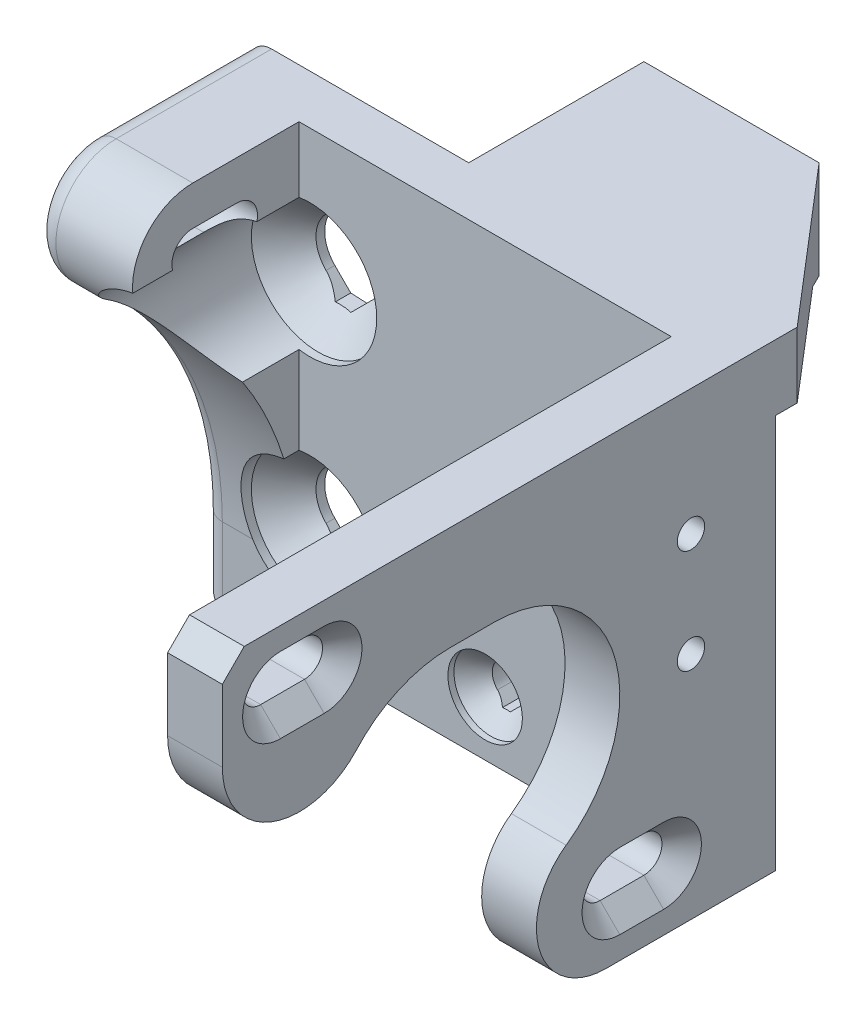
from build123d import *

# Parameters (mm, degrees)
SKETCH1_R                = 3.15
BOSS_EXTRUDE1_DEPTH      = 4.5
SKETCH4_W                = 28
SKETCH4_H                = 6
BOSS_EXTRUDE2_DEPTH      = 16
BOSS_EXTRUDE4_DEPTH      = 6
CHAMFER8_START           = 16
CHAMFER8_DEPTH           = 0.271535122
CHAMFER8_START_2         = -16
CHAMFER8_2_DEPTH         = 10.9
CHAMFER8_START_3         = 16.271535122
CHAMFER8_3_DEPTH         = 5.958767963
CUT_EXTRUDE6_REACH       = 41.038
SKETCH10_R               = 2.15
CUT_EXTRUDE7_REACH       = 48.538
CUT_EXTRUDE7_START       = -7.5
SKETCH11_R               = 4.1
CHAMFER9_SIZE            = 2
SKETCH12_W               = 5
SKETCH12_H               = 42
SKETCH12_W_2             = 9
BOSS_EXTRUDE5_DEPTH      = 46
CUT_EXTRUDE8_DEPTH       = 70.880254722
CUT_EXTRUDE9_DEPTH       = 9
CHAMFER11_SIZE           = 12
CHAMFER11_SIZE2          = 14
CUT_EXTRUDE11_REACH      = 65.592
SKETCH16_R               = 1.6
FILLET1_R                = 2
CHAMFER13_SIZE           = 2
CHAMFER14_SIZE           = 1.8
CUT_EXTRUDE13_DEPTH      = 0.7
CUT_EXTRUDE13_DEPTH_BACK = 64.592452382
SKETCH18_R               = 6.1
CHAMFER15_SIZE           = 3
CUT_EXTRUDE14_DEPTH      = 64.592452417
SKETCH24_R               = 1.25
CUT_EXTRUDE18_DEPTH      = 5
CUT_EXTRUDE19_REACH      = 68.92
SKETCH25_R               = 1.65
CUT_EXTRUDE20_DEPTH      = 0.5
CUT_EXTRUDE20_DEPTH_BACK = 64.592452417
SKETCH26_R               = 3.4
CHAMFER16_SIZE           = 1.8
CUT_EXTRUDE21_DEPTH      = 64.592452417
CUT_EXTRUDE23_DEPTH      = 62.791989808


with BuildPart() as part:
    # Sketch1 → Boss-Extrude1 (new body)
    with BuildSketch(Plane.XY):
        Polygon((-10, 22), (-10, -20), (10, -20), (38, -20), (38, 22), align=None)
        with Locations((0, 10)):
            Circle(SKETCH1_R, mode=Mode.SUBTRACT)
        with Locations((0, -10)):
            Circle(SKETCH1_R, mode=Mode.SUBTRACT)
    extrude(amount=BOSS_EXTRUDE1_DEPTH)

    # Sketch4 → Boss-Extrude2 (add)
    with BuildSketch(Plane.XY):
        with Locations((24, 19)):
            Rectangle(SKETCH4_W, SKETCH4_H)
    extrude(amount=-BOSS_EXTRUDE2_DEPTH)

    # Sketch9 → Boss-Extrude4 (add)
    with BuildSketch(Plane.ZY.offset(-10)):
        with BuildLine():
            Line((-16, 16), (-16, 9.9))
            ThreePointArc((-16, 9.9), (-14.535533906, 6.364466094), (-11, 4.9))
            Line((-11, 4.9), (-5.1, 4.9))
            Line((-5.1, 4.9), (-5.1, 16))
            Line((-5.1, 16), (-16, 16))
        make_face()
    extrude(amount=-BOSS_EXTRUDE4_DEPTH)

    # Chamfer8: read off the stored shape, not the designer's step
    # Chamfer8 outline → Chamfer8 (add)
    with BuildSketch(Plane.YZ.offset(CHAMFER8_START)):
        with BuildLine():
            ThreePointArc((4.9, -11), (6.364466094, -14.535533906), (9.9, -16))
            Line((9.9, -16), (16, -16))
            Line((16, -16), (16, -5.1))
            Line((16, -5.1), (4.9, -5.1))
            Line((4.9, -5.1), (4.9, -11))
        make_face()
    extrude(amount=CHAMFER8_DEPTH)

    # Chamfer8 2 outline → Chamfer8 2 (add)
    with BuildSketch(Plane.XY.offset(CHAMFER8_START_2)):
        Polygon((16.271535122, 4.9), (29.5, 16), (16.271535122, 16), align=None)
    extrude(amount=CHAMFER8_2_DEPTH)

    # Chamfer8 3 outline → Chamfer8 3 (cut)
    with BuildSketch(Plane.YZ.offset(CHAMFER8_START_3)):
        with BuildLine():
            Line((11, -16), (9.9, -16))
            ThreePointArc((9.9, -16), (6.364466094, -14.535533906), (4.9, -11))
            Line((4.9, -11), (4.9, -10))
            Line((4.9, -10), (3, -10))
            Line((3, -10), (3, -17))
            Line((3, -17), (11, -17))
            Line((11, -17), (11, -16))
        make_face()
    extrude(amount=CHAMFER8_3_DEPTH, mode=Mode.SUBTRACT)

    # Cut-Extrude6: up to this plane
    cut_extrude6_end = Plane(origin=(29.5, 16, -16), z_dir=(-0.6427876096865436, 0.7660444431189746, 0))
    # Sketch10 → Cut-Extrude6 (cut, up to the surface)
    with BuildSketch(Plane.ZY.offset(-10), mode=Mode.PRIVATE) as cut_extrude6_sk1:
        with Locations((-11, 9.9)):
            Circle(SKETCH10_R)
    cut_extrude6_tool1 = split(extrude(cut_extrude6_sk1.sketch, amount=-CUT_EXTRUDE6_REACH, mode=Mode.PRIVATE), bisect_by=cut_extrude6_end, keep=Keep.BOTH, mode=Mode.PRIVATE)
    add(cut_extrude6_tool1.solids().sort_by_distance((10, 9.9, -11))[0], mode=Mode.SUBTRACT)

    # Sketch11 → Cut-Extrude7 (cut, up to next)
    with BuildSketch(Plane.ZY.offset(-10).offset(CUT_EXTRUDE7_START), mode=Mode.PRIVATE) as cut_extrude7_sk1:
        with Locations((-11, 9.9)):
            Circle(SKETCH11_R)
    cut_extrude7_tool1 = extrude(cut_extrude7_sk1.sketch, amount=-CUT_EXTRUDE7_REACH, mode=Mode.PRIVATE) & part.part
    add(cut_extrude7_tool1.solids().sort_by_distance((17.5, 9.9, -11))[0], mode=Mode.SUBTRACT)

    # Chamfer9
    # the kernel refuses this chamfer: 2 mm, written as the material it takes off along each edge
    with BuildSketch(Plane(origin=(17.5, 9.9, -11), x_dir=(0, 0, 1), z_dir=(0, -1, 0))) as chamfer9_piece_1_section:
        Polygon((2.15, CHAMFER9_SIZE), (2.15 + CHAMFER9_SIZE, 0), (2.15, 0), align=None)
    chamfer9_piece_1 = revolve(axis=Axis((17.5, 9.9, -11), (-1, 0, 0)), mode=Mode.PRIVATE)
    chamfer9_piece_1 = chamfer9_piece_1 & Plane(origin=(17.5, 9.9, -11), x_dir=(0, 0, 1), z_dir=(-1, 0, 0)) * Cylinder(4.1, 17, mode=Mode.PRIVATE)
    add(chamfer9_piece_1, mode=Mode.SUBTRACT)

    # Sketch12 → Boss-Extrude5 (add)
    with BuildSketch(Plane(origin=(0, 0, 4.5), x_dir=(-1, 0, 0), z_dir=(0, 0, -1))):
        with Locations((-35.5, 1)):
            Rectangle(SKETCH12_W, SKETCH12_H)
        with Locations((5.5, 1)):
            Rectangle(SKETCH12_W_2, SKETCH12_H)
    extrude(amount=-BOSS_EXTRUDE5_DEPTH)

    # Sketch13 → Cut-Extrude8 (cut, through all)
    with BuildSketch(Plane.ZY.offset(-33)):
        with BuildLine():
            Line((50.5, 13.440816458), (50.5, -20))
            Line((50.5, -20), (15.452789361, -20))
            ThreePointArc((15.452789361, -20), (21.523642711, -15.548666157), (19.103870982, -8.420248509))
            ThreePointArc((19.103870982, -8.420248509), (14.732255066, 4.458116694), (25.7, 12.5))
            Line((25.7, 12.5), (29.7, 12.5))
            ThreePointArc((29.7, 12.5), (34.412206111, 11.490238966), (38.296898811, 8.63828062))
            ThreePointArc((38.296898811, 8.63828062), (46.033962348, 6.883758636), (50.5, 13.440816458))
        make_face()
        with BuildLine():
            Line((41.2, 14.85), (45.2, 14.85))
            ThreePointArc((45.2, 14.85), (46.85, 16.5), (45.2, 18.15))
            Line((45.2, 18.15), (41.2, 18.15))
            ThreePointArc((41.2, 18.15), (39.55, 16.5), (41.2, 14.85))
        make_face()
        with BuildLine():
            Line((10.2, -16.15), (14.2, -16.15))
            ThreePointArc((14.2, -16.15), (15.85, -14.5), (14.2, -12.85))
            Line((14.2, -12.85), (10.2, -12.85))
            ThreePointArc((10.2, -12.85), (8.55, -14.5), (10.2, -16.15))
        make_face()
    extrude(amount=-CUT_EXTRUDE8_DEPTH, mode=Mode.SUBTRACT)

    # Sketch14 → Cut-Extrude9 (cut)
    with BuildSketch(Plane.ZY.offset(10)):
        with BuildLine():
            Line((14.2, 18.408592628), (10.2, 18.408592628))
            ThreePointArc((10.2, 18.408592628), (8.291407372, 16.5), (10.2, 14.591407372))
            Line((10.2, 14.591407372), (14.2, 14.591407372))
            ThreePointArc((14.2, 14.591407372), (16.108592628, 16.5), (14.2, 18.408592628))
        make_face()
        with BuildLine():
            Line((4.5, -13.140512816), (4.5, -44.140512816))
            Line((4.5, -44.140512816), (35.5, -44.140512816))
            ThreePointArc((35.5, -44.140512816), (57.420310217, -35.060823033), (66.5, -13.140512816))
            Line((66.5, -13.140512816), (66.5, 22))
            Line((66.5, 22), (14.2, 22))
            ThreePointArc((14.2, 22), (19.435221225, 18.185959291), (17.409589041, 12.033621356))
            ThreePointArc((17.409589041, 12.033621356), (7.915559279, 1.00510948), (4.5, -13.140512816))
        make_face()
    extrude(amount=-CUT_EXTRUDE9_DEPTH, mode=Mode.SUBTRACT)

    # Chamfer11
    chamfer11_edges = [part.edges().sort_by_distance(p)[0] for p in [
        (38, 19, -16),
    ]]
    chamfer11_side = [part.faces().sort_by_distance(p)[0] for p in [
        (21.833057839, 16.873831954, -16),
    ]]
    chamfer(chamfer11_edges, length=CHAMFER11_SIZE, length2=CHAMFER11_SIZE2, reference=chamfer11_side[0])

    # Sketch16 → Cut-Extrude11 (cut, up to next)
    with BuildSketch(Plane.XY.offset(4.5), mode=Mode.PRIVATE) as cut_extrude11_sk1:
        with Locations((30, -8)):
            Circle(SKETCH16_R)
    cut_extrude11_tool1 = extrude(cut_extrude11_sk1.sketch, amount=-CUT_EXTRUDE11_REACH, mode=Mode.PRIVATE) & part.part
    add(cut_extrude11_tool1.solids().sort_by_distance((30, -8, 4.5))[0], mode=Mode.SUBTRACT)

    # Fillet1
    fillet1_edges = [part.edges().sort_by_distance(p)[0] for p in [
        (-10, -20, 2.25),
        (-10, 22, 7.1),
        (-10, -16.570256408, 4.5),
        (-10, 1.00510948, 7.915559279),
        (-10, 18.185959291, 19.435221225),
    ]]
    fillet(fillet1_edges, radius=FILLET1_R)

    # Chamfer13
    chamfer13_edges = [part.edges().sort_by_distance(p)[0] for p in [
        (35.5, 22, 50.5),
    ]]
    chamfer(chamfer13_edges, length=CHAMFER13_SIZE)

    # Chamfer14
    chamfer14_edges = [part.edges().sort_by_distance(p)[0] for p in [
        (38, 16.5, 39.55),
        (38, 18.15, 43.2),
        (38, 16.5, 46.85),
        (38, 14.85, 43.2),
        (38, -14.5, 8.55),
        (38, -12.85, 12.2),
        (38, -14.5, 15.85),
        (38, -16.15, 12.2),
    ]]
    chamfer(chamfer14_edges, length=CHAMFER14_SIZE)

    # Sketch18 → Cut-Extrude13 (cut, two sides: drawn at the far end of the back side and taken through both)
    with BuildSketch(Plane(origin=(0, 0, 4.5), x_dir=(-1, 0, 0), z_dir=(0, 0, -1)).offset(-CUT_EXTRUDE13_DEPTH_BACK)):
        with Locations((0, 10)):
            Circle(SKETCH18_R)
        with Locations((0, -10)):
            Circle(SKETCH18_R)
    extrude(amount=CUT_EXTRUDE13_DEPTH + CUT_EXTRUDE13_DEPTH_BACK, mode=Mode.SUBTRACT)

    # Chamfer15
    # the kernel refuses this chamfer: 3 mm, written as the material it takes off along each edge
    with BuildSketch(Plane(origin=(0, -10, 3.8), x_dir=(1, 0, 0), z_dir=(0, 1, 0))) as chamfer15_piece_1_section:
        Polygon((3.15 + CHAMFER15_SIZE, 0), (3.15, CHAMFER15_SIZE), (3.15, 0), align=None)
    chamfer15_piece_1 = revolve(axis=Axis((0, -10, 3.8), (0, 0, -1)), mode=Mode.PRIVATE)
    chamfer15_piece_1 = chamfer15_piece_1 & Plane(origin=(0, -10, 3.8), x_dir=(-1, 0, 0), z_dir=(0, 0, 1)) * Cylinder(6.1, 25, mode=Mode.PRIVATE)
    add(chamfer15_piece_1, mode=Mode.SUBTRACT)
    with BuildSketch(Plane(origin=(0, 10, 3.8), x_dir=(1, 0, 0), z_dir=(0, 1, 0))) as chamfer15_piece_2_section:
        Polygon((3.15 + CHAMFER15_SIZE, 0), (3.15, CHAMFER15_SIZE), (3.15, 0), align=None)
    chamfer15_piece_2 = revolve(axis=Axis((0, 10, 3.8), (0, 0, -1)), mode=Mode.PRIVATE)
    chamfer15_piece_2 = chamfer15_piece_2 & Plane(origin=(0, 10, 3.8), x_dir=(-1, 0, 0), z_dir=(0, 0, 1)) * Cylinder(6.1, 25, mode=Mode.PRIVATE)
    add(chamfer15_piece_2, mode=Mode.SUBTRACT)

    # Sketch20 → Cut-Extrude14 (cut, through all)
    with BuildSketch(Plane.XY.offset(4.5)):
        Polygon((0, -10), (2.227386361, -12.227386361), (0.684772721, -13.77), (-0.684772721, -13.77), (-2.227386361, -12.227386361), align=None)
        Polygon((0.699417382, 6.244644661), (-0.772212816, 6.317440094), (-2.227386361, 7.772613639), (0, 10), (2.227386361, 7.772613639), align=None)
    extrude(amount=-CUT_EXTRUDE14_DEPTH, mode=Mode.SUBTRACT)

    # Sketch24 → Cut-Extrude18 (cut)
    with BuildSketch(Plane(origin=(38, 0, 0), x_dir=(0, 0, -1), z_dir=(1, 0, 0))):
        with Locations(Location((-7.7, 10.5, 0), (0, 0, 90))):
            Circle(SKETCH24_R)
        with Locations(Location((-7.7, 1, 0), (0, 0, 90))):
            Circle(SKETCH24_R)
    extrude(amount=-CUT_EXTRUDE18_DEPTH, mode=Mode.SUBTRACT)

    # Sketch25 → Cut-Extrude19 (cut, up to next)
    with BuildSketch(Plane(origin=(0, 0, 0), x_dir=(-1, 0, 0), z_dir=(0, 0, -1)), mode=Mode.PRIVATE) as cut_extrude19_sk1:
        with Locations((-16, -15)):
            Circle(SKETCH25_R)
    cut_extrude19_tool1 = extrude(cut_extrude19_sk1.sketch, amount=-CUT_EXTRUDE19_REACH, mode=Mode.PRIVATE) & part.part
    # Sketch25 → Cut-Extrude19 (cut, up to next)
    with BuildSketch(Plane(origin=(0, 0, 0), x_dir=(-1, 0, 0), z_dir=(0, 0, -1)), mode=Mode.PRIVATE) as cut_extrude19_sk2:
        with Locations((-28, 10)):
            Circle(SKETCH25_R)
    cut_extrude19_tool2 = extrude(cut_extrude19_sk2.sketch, amount=-CUT_EXTRUDE19_REACH, mode=Mode.PRIVATE) & part.part
    add(cut_extrude19_tool1.solids().sort_by_distance((16, -15, 0))[0], mode=Mode.SUBTRACT)
    add(cut_extrude19_tool2.solids().sort_by_distance((28, 10, 0))[0], mode=Mode.SUBTRACT)

    # Sketch26 → Cut-Extrude20 (cut, two sides: drawn at the far end of the back side and taken through both)
    with BuildSketch(Plane(origin=(0, 0, 4.5), x_dir=(-1, 0, 0), z_dir=(0, 0, -1)).offset(-CUT_EXTRUDE20_DEPTH_BACK)):
        with Locations((-16, -15)):
            Circle(SKETCH26_R)
        with Locations((-28, 10)):
            Circle(SKETCH26_R)
    extrude(amount=CUT_EXTRUDE20_DEPTH + CUT_EXTRUDE20_DEPTH_BACK, mode=Mode.SUBTRACT)

    # Chamfer16
    # the kernel refuses this chamfer: 1.8 mm, written as the material it takes off along each edge
    with BuildSketch(Plane(origin=(28, 10, 4), x_dir=(-1, 0, 0), z_dir=(0, -1, 0))) as chamfer16_piece_1_section:
        Polygon((1.65, CHAMFER16_SIZE), (1.65 + CHAMFER16_SIZE, 0), (1.65, 0), align=None)
    chamfer16_piece_1 = revolve(axis=Axis((28, 10, 4), (0, 0, -1)), mode=Mode.PRIVATE)
    chamfer16_piece_1 = chamfer16_piece_1 & Plane(origin=(28, 10, 4), x_dir=(-1, 0, 0), z_dir=(0, 0, 1)) * Cylinder(3.4, 14, mode=Mode.PRIVATE)
    add(chamfer16_piece_1, mode=Mode.SUBTRACT)
    with BuildSketch(Plane(origin=(16, -15, 4), x_dir=(-1, 0, 0), z_dir=(0, -1, 0))) as chamfer16_piece_2_section:
        Polygon((1.65, CHAMFER16_SIZE), (1.65 + CHAMFER16_SIZE, 0), (1.65, 0), align=None)
    chamfer16_piece_2 = revolve(axis=Axis((16, -15, 4), (0, 0, -1)), mode=Mode.PRIVATE)
    chamfer16_piece_2 = chamfer16_piece_2 & Plane(origin=(16, -15, 4), x_dir=(-1, 0, 0), z_dir=(0, 0, 1)) * Cylinder(3.4, 14, mode=Mode.PRIVATE)
    add(chamfer16_piece_2, mode=Mode.SUBTRACT)

    # Sketch27 → Cut-Extrude21 (cut, through all)
    with BuildSketch(Plane.XY.offset(4.5)):
        Polygon((16, -15), (14.833273811, -16.166726189), (15.646547622, -16.98), (16.353452378, -16.98), (17.166726189, -16.166726189), align=None)
        Polygon((26.833273811, 8.833273811), (27.646547622, 8.02), (28.353452378, 8.02), (29.166726189, 8.833273811), (28, 10), align=None)
    extrude(amount=-CUT_EXTRUDE21_DEPTH, mode=Mode.SUBTRACT)

    # Sketch29 → Cut-Extrude23 (cut, through all)
    with BuildSketch(Plane.ZY.offset(-10)):
        Polygon((-11, 9.9), (-12.52027958, 8.37972042), (-11.470559159, 7.33), (-10.529440841, 7.33), (-9.47972042, 8.37972042), align=None)
    extrude(amount=-CUT_EXTRUDE23_DEPTH, mode=Mode.SUBTRACT)


solid = part.part
